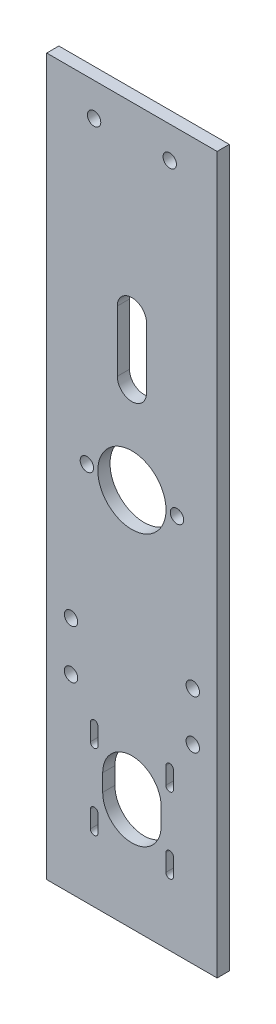
from build123d import *

# Parameters (mm, degrees)
SKETCH1_W           = 70
SKETCH1_H           = 176.037854918
SKETCH1_R           = 2.75
SKETCH1_R_2         = 14
BOSS_EXTRUDE1_DEPTH = 5
SKETCH1_4_W         = 70
SKETCH1_4_H         = 118
SKETCH1_4_R         = 2.75
BOSS_EXTRUDE2_DEPTH = 5


with BuildPart() as part:
    # Sketch1 → Boss-Extrude1 (new body)
    with BuildSketch(Plane.XY):
        Rectangle(SKETCH1_W, SKETCH1_H)
        with BuildLine():
            ThreePointArc((-17.05, -53.981072541), (-15.5, -52.431072541), (-13.95, -53.981072541))
            Line((-13.95, -53.981072541), (-13.95, -60.981072541))
            ThreePointArc((-13.95, -60.981072541), (-15.5, -62.531072541), (-17.05, -60.981072541))
            Line((-17.05, -60.981072541), (-17.05, -53.981072541))
        make_face(mode=Mode.SUBTRACT)
        with BuildLine():
            ThreePointArc((-17.05, -22.981072541), (-15.5, -21.431072541), (-13.95, -22.981072541))
            Line((-13.95, -22.981072541), (-13.95, -29.981072541))
            ThreePointArc((-13.95, -29.981072541), (-15.5, -31.531072541), (-17.05, -29.981072541))
            Line((-17.05, -29.981072541), (-17.05, -22.981072541))
        make_face(mode=Mode.SUBTRACT)
        with Locations((-25, -10)):
            Circle(SKETCH1_R, mode=Mode.SUBTRACT)
        with Locations((-25, 10)):
            Circle(SKETCH1_R, mode=Mode.SUBTRACT)
        with BuildLine():
            ThreePointArc((13.95, -53.981072541), (15.5, -52.431072541), (17.05, -53.981072541))
            Line((17.05, -53.981072541), (17.05, -60.981072541))
            ThreePointArc((17.05, -60.981072541), (15.5, -62.531072541), (13.95, -60.981072541))
            Line((13.95, -60.981072541), (13.95, -53.981072541))
        make_face(mode=Mode.SUBTRACT)
        with BuildLine():
            ThreePointArc((12, -45.481072541), (0, -57.481072541), (-12, -45.481072541))
            Line((-12, -45.481072541), (-12, -38.481072541))
            ThreePointArc((-12, -38.481072541), (0, -26.481072541), (12, -38.481072541))
            Line((12, -38.481072541), (12, -45.481072541))
        make_face(mode=Mode.SUBTRACT)
        with BuildLine():
            ThreePointArc((13.95, -22.981072541), (15.5, -21.431072541), (17.05, -22.981072541))
            Line((17.05, -22.981072541), (17.05, -29.981072541))
            ThreePointArc((17.05, -29.981072541), (15.5, -31.531072541), (13.95, -29.981072541))
            Line((13.95, -29.981072541), (13.95, -22.981072541))
        make_face(mode=Mode.SUBTRACT)
        with Locations((25, -10)):
            Circle(SKETCH1_R, mode=Mode.SUBTRACT)
        with Locations((25, 10)):
            Circle(SKETCH1_R, mode=Mode.SUBTRACT)
        with Locations((-18.5, 68.018927459)):
            Circle(SKETCH1_R, mode=Mode.SUBTRACT)
        with Locations((0, 68.018927459)):
            Circle(SKETCH1_R_2, mode=Mode.SUBTRACT)
        with Locations((18.5, 68.018927459)):
            Circle(SKETCH1_R, mode=Mode.SUBTRACT)
    extrude(amount=BOSS_EXTRUDE1_DEPTH)

    # Sketch1<4> → Boss-Extrude2 (add)
    with BuildSketch(Plane.XY):
        with Locations((0, 147.018927459)):
            Rectangle(SKETCH1_4_W, SKETCH1_4_H)
        with Locations((-15.541353378, 192.447045681)):
            Circle(SKETCH1_4_R, mode=Mode.SUBTRACT)
        with BuildLine():
            ThreePointArc((-6, 130.518927459), (0, 136.518927459), (6, 130.518927459))
            Line((6, 130.518927459), (6, 105.518927459))
            ThreePointArc((6, 105.518927459), (0, 99.518927459), (-6, 105.518927459))
            Line((-6, 105.518927459), (-6, 130.518927459))
        make_face(mode=Mode.SUBTRACT)
        with Locations((15.541353378, 193.050095019)):
            Circle(SKETCH1_4_R, mode=Mode.SUBTRACT)
    extrude(amount=BOSS_EXTRUDE2_DEPTH)


solid = part.part
